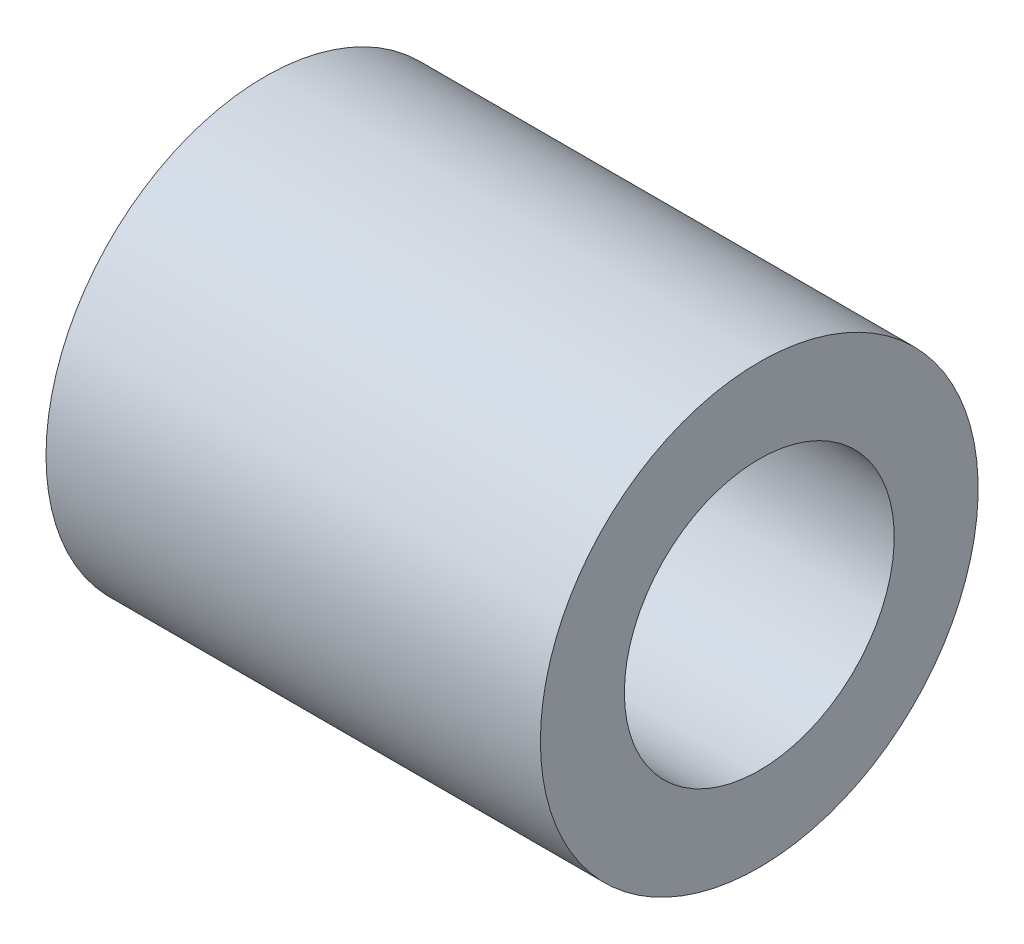
from build123d import *

# Parameters (mm, degrees)
SKETCH1_R           = 5.3975
SKETCH1_R_2         = 3.3274
BOSS_EXTRUDE1_DEPTH = 12.192


with BuildPart() as part:
    # Sketch1 → Boss-Extrude1 (new body)
    with BuildSketch(Plane(origin=(0, 0, 0), x_dir=(0, 0, -1), z_dir=(1, 0, 0))):
        Circle(SKETCH1_R)
        Circle(SKETCH1_R_2, mode=Mode.SUBTRACT)
    extrude(amount=BOSS_EXTRUDE1_DEPTH)


solid = part.part
